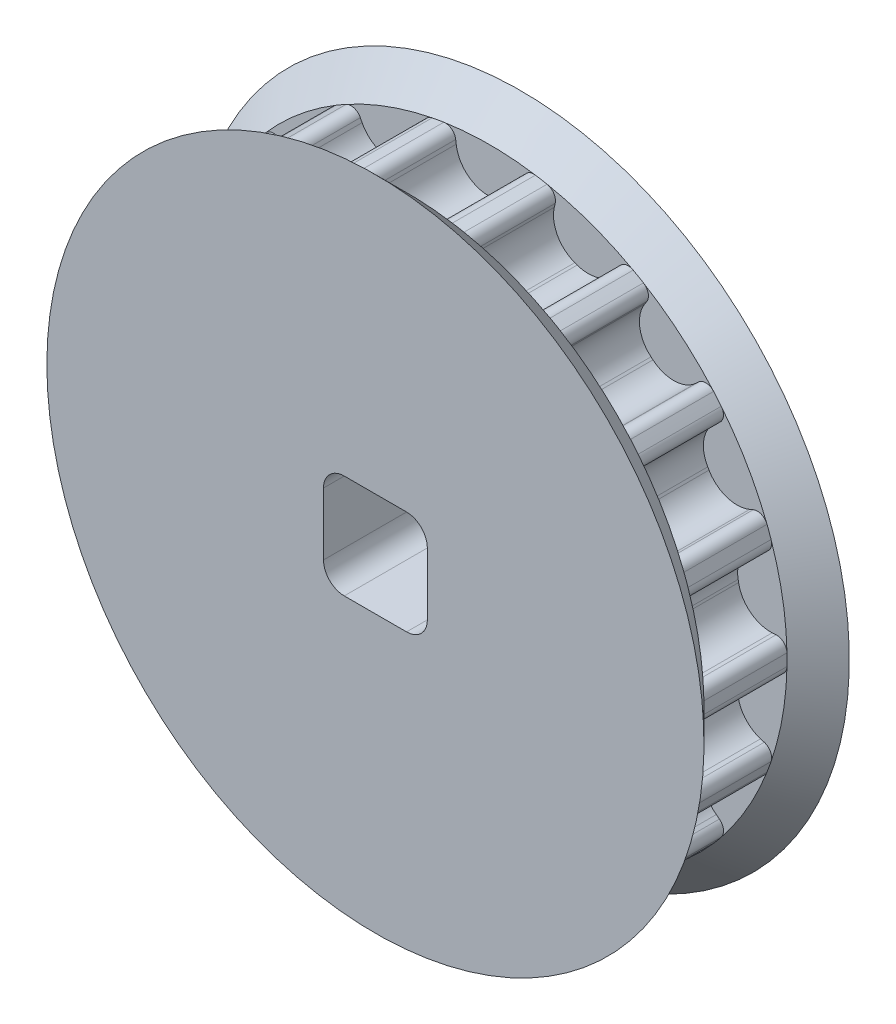
from build123d import *

# Parameters (mm, degrees)
EXTRUDE_1_DEPTH             = 2
SKETCH_3_R                  = 15.823944878
EXTRUDE_2_DEPTH             = 1.5
CHAMFER_1_SIZE              = 1.5
CHAMFER_1_OF_MIRROR_10_SIZE = 1.5
CUT_EXTRUDE_1_DEPTH         = 24.447696327


with BuildPart() as part:
    # 草图1 → 凸台-拉伸1 (new, symmetric)
    with BuildSketch(Plane.XY):
        with BuildLine():
            Line((-1.632898618, 13.71992731), (-1.610048582, 13.533828703))
            ThreePointArc((-1.610048582, 13.533828703), (-1.095363861, 12.555573954), (-0.061676586, 12.163944878))
            Line((-0.061676586, 12.163944878), (0.061676586, 12.163944878))
            ThreePointArc((0.061676586, 12.163944878), (1.095363861, 12.555573954), (1.610048582, 13.533828703))
            Line((1.610048582, 13.533828703), (1.632898618, 13.71992731))
            ThreePointArc((1.632898618, 13.71992731), (1.827776535, 14.057942458), (2.206181973, 14.15302646))
            ThreePointArc((2.206181973, 14.15302646), (2.346870584, 14.130378457), (2.487326925, 14.10633197))
            ThreePointArc((2.487326925, 14.10633197), (2.627537096, 14.080889378), (2.767487219, 14.054053201))
            ThreePointArc((2.767487219, 14.054053201), (3.090551372, 13.835281183), (3.158068723, 13.45099867))
            Line((3.158068723, 13.45099867), (3.115891261, 13.26830801))
            ThreePointArc((3.115891261, 13.26830801), (3.264953866, 12.173016699), (4.102357138, 11.451463876))
            Line((4.102357138, 11.451463876), (4.218271203, 11.409274607))
            ThreePointArc((4.218271203, 11.409274607), (5.323564541, 11.423743689), (6.141792805, 12.166969916))
            Line((6.141792805, 12.166969916), (6.226914287, 12.334030232))
            ThreePointArc((6.226914287, 12.334030232), (6.525647617, 12.585008398), (6.913753058, 12.544935852))
            ThreePointArc((6.913753058, 12.544935852), (7.038211035, 12.475535352), (7.161972439, 12.404900147))
            ThreePointArc((7.161972439, 12.404900147), (7.285025023, 12.333037229), (7.407356607, 12.25995371))
            ThreePointArc((7.407356607, 12.25995371), (7.636113171, 11.943880812), (7.568126368, 11.559681076))
            Line((7.568126368, 11.559681076), (7.466008632, 11.402433551))
            ThreePointArc((7.466008632, 11.402433551), (7.231469971, 10.322213976), (7.771586047, 9.357767326))
            Line((7.771586047, 9.357767326), (7.866080059, 9.278477435))
            ThreePointArc((7.866080059, 9.278477435), (8.909664769, 8.91404134), (9.932746171, 9.332594992))
            Line((9.932746171, 9.332594992), (10.069872193, 9.460467076))
            ThreePointArc((10.069872193, 9.460467076), (10.436429288, 9.594136591), (10.787423489, 9.423740836))
            ThreePointArc((10.787423489, 9.423740836), (10.880639362, 9.315958563), (10.972778378, 9.20725429))
            ThreePointArc((10.972778378, 9.20725429), (11.063831417, 9.097638774), (11.153789468, 8.987122864))
            ThreePointArc((11.153789468, 8.987122864), (11.260647026, 8.611872141), (11.065356279, 8.27409534))
            Line((11.065356279, 8.27409534), (10.915615176, 8.161257325))
            ThreePointArc((10.915615176, 8.161257325), (10.325764073, 7.226399907), (10.503446982, 6.135385929))
            Line((10.503446982, 6.135385929), (10.565123568, 6.028558949))
            ThreePointArc((10.565123568, 6.028558949), (11.421127934, 5.329174047), (12.525663758, 5.372571378))
            Line((12.525663758, 5.372571378), (12.698254898, 5.44583197))
            ThreePointArc((12.698254898, 5.44583197), (13.088423561, 5.446070317), (13.359971441, 5.165903596))
            ThreePointArc((13.359971441, 5.165903596), (13.410702001, 5.032739684), (13.460105303, 4.89907768))
            ThreePointArc((13.460105303, 4.89907768), (13.508176457, 4.764930815), (13.554910707, 4.630312365))
            ThreePointArc((13.554910707, 4.630312365), (13.526980659, 4.241144592), (13.227940916, 3.990531594))
            Line((13.227940916, 3.990531594), (13.048637432, 3.935713018))
            ThreePointArc((13.048637432, 3.935713018), (12.174618635, 3.258975359), (11.968437197, 2.172986441))
            Line((11.968437197, 2.172986441), (11.98985725, 2.051507281))
            ThreePointArc((11.98985725, 2.051507281), (12.555034512, 1.101529714), (13.607801437, 0.764536364))
            Line((13.607801437, 0.764536364), (13.795040655, 0.774349156))
            ThreePointArc((13.795040655, 0.774349156), (14.161760788, 0.641127587), (14.321109666, 0.284982142))
            ThreePointArc((14.321109666, 0.284982142), (14.323236058, 0.142498123), (14.323944878, 0))
            ThreePointArc((14.323944878, 0), (14.323236058, -0.142498123), (14.321109666, -0.284982142))
            ThreePointArc((14.321109666, -0.284982142), (14.161760788, -0.641127587), (13.795040655, -0.774349156))
            Line((13.795040655, -0.774349156), (13.607801437, -0.764536364))
            ThreePointArc((13.607801437, -0.764536364), (12.555034512, -1.101529714), (11.98985725, -2.051507281))
            Line((11.98985725, -2.051507281), (11.968437197, -2.172986441))
            ThreePointArc((11.968437197, -2.172986441), (12.174618635, -3.258975359), (13.048637432, -3.935713018))
            Line((13.048637432, -3.935713018), (13.227940916, -3.990531594))
            ThreePointArc((13.227940916, -3.990531594), (13.526980659, -4.241144592), (13.554910707, -4.630312365))
            ThreePointArc((13.554910707, -4.630312365), (13.508176457, -4.764930815), (13.460105303, -4.89907768))
            ThreePointArc((13.460105303, -4.89907768), (13.410702001, -5.032739684), (13.359971441, -5.165903596))
            ThreePointArc((13.359971441, -5.165903596), (13.088423561, -5.446070317), (12.698254898, -5.44583197))
            Line((12.698254898, -5.44583197), (12.525663758, -5.372571378))
            ThreePointArc((12.525663758, -5.372571378), (11.421127934, -5.329174047), (10.565123568, -6.028558949))
            Line((10.565123568, -6.028558949), (10.503446982, -6.135385929))
            ThreePointArc((10.503446982, -6.135385929), (10.325764073, -7.226399907), (10.915615176, -8.161257325))
            Line((10.915615176, -8.161257325), (11.065356279, -8.27409534))
            ThreePointArc((11.065356279, -8.27409534), (11.260647026, -8.611872141), (11.153789469, -8.987122864))
            ThreePointArc((11.153789469, -8.987122864), (11.063831417, -9.097638774), (10.972778378, -9.20725429))
            ThreePointArc((10.972778378, -9.20725429), (10.880639362, -9.315958563), (10.787423489, -9.423740836))
            ThreePointArc((10.787423489, -9.423740836), (10.436429288, -9.594136591), (10.069872193, -9.460467076))
            Line((10.069872193, -9.460467076), (9.932746171, -9.332594992))
            ThreePointArc((9.932746171, -9.332594992), (8.909664769, -8.91404134), (7.866080059, -9.278477435))
            Line((7.866080059, -9.278477435), (7.771586047, -9.357767326))
            ThreePointArc((7.771586047, -9.357767326), (7.231469971, -10.322213976), (7.466008632, -11.402433551))
            Line((7.466008632, -11.402433551), (7.568126368, -11.559681076))
            ThreePointArc((7.568126368, -11.559681076), (7.636113171, -11.943880812), (7.407356607, -12.25995371))
            ThreePointArc((7.407356607, -12.25995371), (7.285025023, -12.333037229), (7.161972439, -12.404900147))
            ThreePointArc((7.161972439, -12.404900147), (7.038211035, -12.475535352), (6.913753058, -12.544935852))
            ThreePointArc((6.913753058, -12.544935852), (6.525647617, -12.585008398), (6.226914287, -12.334030232))
            Line((6.226914287, -12.334030232), (6.141792805, -12.166969916))
            ThreePointArc((6.141792805, -12.166969916), (5.323564541, -11.423743689), (4.218271203, -11.409274607))
            Line((4.218271203, -11.409274607), (4.102357138, -11.451463876))
            ThreePointArc((4.102357138, -11.451463876), (3.264953866, -12.173016699), (3.115891261, -13.26830801))
            Line((3.115891261, -13.26830801), (3.158068723, -13.45099867))
            ThreePointArc((3.158068723, -13.45099867), (3.090551372, -13.835281183), (2.767487219, -14.054053201))
            ThreePointArc((2.767487219, -14.054053201), (2.627537096, -14.080889378), (2.487326925, -14.10633197))
            ThreePointArc((2.487326925, -14.10633197), (2.346870584, -14.130378457), (2.206181973, -14.15302646))
            ThreePointArc((2.206181973, -14.15302646), (1.827776535, -14.057942458), (1.632898618, -13.71992731))
            Line((1.632898618, -13.71992731), (1.610048582, -13.533828703))
            ThreePointArc((1.610048582, -13.533828703), (1.095363861, -12.555573954), (0.061676586, -12.163944878))
            Line((0.061676586, -12.163944878), (-0.061676586, -12.163944878))
            ThreePointArc((-0.061676586, -12.163944878), (-1.095363861, -12.555573954), (-1.610048582, -13.533828703))
            Line((-1.610048582, -13.533828703), (-1.632898618, -13.71992731))
            ThreePointArc((-1.632898618, -13.71992731), (-1.827776535, -14.057942458), (-2.206181973, -14.15302646))
            ThreePointArc((-2.206181973, -14.15302646), (-2.346870584, -14.130378457), (-2.487326925, -14.10633197))
            ThreePointArc((-2.487326925, -14.10633197), (-2.627537096, -14.080889378), (-2.767487219, -14.054053201))
            ThreePointArc((-2.767487219, -14.054053201), (-3.090551372, -13.835281183), (-3.158068723, -13.45099867))
            Line((-3.158068723, -13.45099867), (-3.115891261, -13.26830801))
            ThreePointArc((-3.115891261, -13.26830801), (-3.264953866, -12.173016699), (-4.102357138, -11.451463876))
            Line((-4.102357138, -11.451463876), (-4.218271203, -11.409274607))
            ThreePointArc((-4.218271203, -11.409274607), (-5.323564541, -11.423743689), (-6.141792805, -12.166969916))
            Line((-6.141792805, -12.166969916), (-6.226914287, -12.334030232))
            ThreePointArc((-6.226914287, -12.334030232), (-6.525647617, -12.585008398), (-6.913753058, -12.544935852))
            ThreePointArc((-6.913753058, -12.544935852), (-7.038211035, -12.475535352), (-7.161972439, -12.404900147))
            ThreePointArc((-7.161972439, -12.404900147), (-7.285025023, -12.333037229), (-7.407356607, -12.25995371))
            ThreePointArc((-7.407356607, -12.25995371), (-7.636113171, -11.943880812), (-7.568126368, -11.559681076))
            Line((-7.568126368, -11.559681076), (-7.466008632, -11.402433551))
            ThreePointArc((-7.466008632, -11.402433551), (-7.231469971, -10.322213976), (-7.771586047, -9.357767326))
            Line((-7.771586047, -9.357767326), (-7.866080059, -9.278477435))
            ThreePointArc((-7.866080059, -9.278477435), (-8.909664769, -8.91404134), (-9.932746171, -9.332594992))
            Line((-9.932746171, -9.332594992), (-10.069872193, -9.460467076))
            ThreePointArc((-10.069872193, -9.460467076), (-10.436429288, -9.594136591), (-10.787423489, -9.423740836))
            ThreePointArc((-10.787423489, -9.423740836), (-10.880639362, -9.315958563), (-10.972778378, -9.20725429))
            ThreePointArc((-10.972778378, -9.20725429), (-11.063831417, -9.097638774), (-11.153789468, -8.987122864))
            ThreePointArc((-11.153789468, -8.987122864), (-11.260647026, -8.611872141), (-11.065356279, -8.27409534))
            Line((-11.065356279, -8.27409534), (-10.915615176, -8.161257325))
            ThreePointArc((-10.915615176, -8.161257325), (-10.325764073, -7.226399907), (-10.503446982, -6.135385929))
            Line((-10.503446982, -6.135385929), (-10.565123568, -6.028558949))
            ThreePointArc((-10.565123568, -6.028558949), (-11.421127934, -5.329174047), (-12.525663758, -5.372571378))
            Line((-12.525663758, -5.372571378), (-12.698254898, -5.44583197))
            ThreePointArc((-12.698254898, -5.44583197), (-13.088423561, -5.446070317), (-13.359971441, -5.165903596))
            ThreePointArc((-13.359971441, -5.165903596), (-13.410702001, -5.032739684), (-13.460105303, -4.89907768))
            ThreePointArc((-13.460105303, -4.89907768), (-13.508176457, -4.764930815), (-13.554910707, -4.630312365))
            ThreePointArc((-13.554910707, -4.630312365), (-13.526980659, -4.241144592), (-13.227940916, -3.990531594))
            Line((-13.227940916, -3.990531594), (-13.048637432, -3.935713018))
            ThreePointArc((-13.048637432, -3.935713018), (-12.174618635, -3.258975359), (-11.968437197, -2.172986441))
            Line((-11.968437197, -2.172986441), (-11.98985725, -2.051507281))
            ThreePointArc((-11.98985725, -2.051507281), (-12.555034512, -1.101529714), (-13.607801437, -0.764536364))
            Line((-13.607801437, -0.764536364), (-13.795040655, -0.774349156))
            ThreePointArc((-13.795040655, -0.774349156), (-14.161760788, -0.641127587), (-14.321109666, -0.284982142))
            ThreePointArc((-14.321109666, -0.284982142), (-14.323236058, -0.142498123), (-14.323944878, 0))
            ThreePointArc((-14.323944878, 0), (-14.323236058, 0.142498123), (-14.321109666, 0.284982142))
            ThreePointArc((-14.321109666, 0.284982142), (-14.161760788, 0.641127587), (-13.795040655, 0.774349156))
            Line((-13.795040655, 0.774349156), (-13.607801437, 0.764536364))
            ThreePointArc((-13.607801437, 0.764536364), (-12.555034512, 1.101529714), (-11.98985725, 2.051507281))
            Line((-11.98985725, 2.051507281), (-11.968437197, 2.172986441))
            ThreePointArc((-11.968437197, 2.172986441), (-12.174618635, 3.258975359), (-13.048637432, 3.935713018))
            Line((-13.048637432, 3.935713018), (-13.227940916, 3.990531594))
            ThreePointArc((-13.227940916, 3.990531594), (-13.526980659, 4.241144592), (-13.554910707, 4.630312365))
            ThreePointArc((-13.554910707, 4.630312365), (-13.508176457, 4.764930815), (-13.460105303, 4.89907768))
            ThreePointArc((-13.460105303, 4.89907768), (-13.410702001, 5.032739684), (-13.359971441, 5.165903596))
            ThreePointArc((-13.359971441, 5.165903596), (-13.088423561, 5.446070317), (-12.698254898, 5.44583197))
            Line((-12.698254898, 5.44583197), (-12.525663758, 5.372571378))
            ThreePointArc((-12.525663758, 5.372571378), (-11.421127934, 5.329174047), (-10.565123568, 6.028558949))
            Line((-10.565123568, 6.028558949), (-10.503446982, 6.135385929))
            ThreePointArc((-10.503446982, 6.135385929), (-10.325764073, 7.226399907), (-10.915615176, 8.161257325))
            Line((-10.915615176, 8.161257325), (-11.065356279, 8.27409534))
            ThreePointArc((-11.065356279, 8.27409534), (-11.260647026, 8.611872141), (-11.153789468, 8.987122864))
            ThreePointArc((-11.153789468, 8.987122864), (-11.063831417, 9.097638774), (-10.972778378, 9.20725429))
            ThreePointArc((-10.972778378, 9.20725429), (-10.880639362, 9.315958563), (-10.787423489, 9.423740836))
            ThreePointArc((-10.787423489, 9.423740836), (-10.436429288, 9.594136591), (-10.069872193, 9.460467076))
            Line((-10.069872193, 9.460467076), (-9.932746171, 9.332594992))
            ThreePointArc((-9.932746171, 9.332594992), (-8.909664769, 8.91404134), (-7.866080059, 9.278477435))
            Line((-7.866080059, 9.278477435), (-7.771586047, 9.357767326))
            ThreePointArc((-7.771586047, 9.357767326), (-7.231469971, 10.322213976), (-7.466008632, 11.402433551))
            Line((-7.466008632, 11.402433551), (-7.568126368, 11.559681076))
            ThreePointArc((-7.568126368, 11.559681076), (-7.636113171, 11.943880812), (-7.407356607, 12.25995371))
            ThreePointArc((-7.407356607, 12.25995371), (-7.285025023, 12.333037229), (-7.161972439, 12.404900147))
            ThreePointArc((-7.161972439, 12.404900147), (-7.038211035, 12.475535352), (-6.913753058, 12.544935852))
            ThreePointArc((-6.913753058, 12.544935852), (-6.525647617, 12.585008398), (-6.226914287, 12.334030232))
            Line((-6.226914287, 12.334030232), (-6.141792805, 12.166969916))
            ThreePointArc((-6.141792805, 12.166969916), (-5.323564541, 11.423743689), (-4.218271203, 11.409274607))
            Line((-4.218271203, 11.409274607), (-4.102357138, 11.451463876))
            ThreePointArc((-4.102357138, 11.451463876), (-3.264953866, 12.173016699), (-3.115891261, 13.26830801))
            Line((-3.115891261, 13.26830801), (-3.158068723, 13.45099867))
            ThreePointArc((-3.158068723, 13.45099867), (-3.090551372, 13.835281183), (-2.767487219, 14.054053201))
            ThreePointArc((-2.767487219, 14.054053201), (-2.627537096, 14.080889378), (-2.487326925, 14.10633197))
            ThreePointArc((-2.487326925, 14.10633197), (-2.346870584, 14.130378457), (-2.206181973, 14.15302646))
            ThreePointArc((-2.206181973, 14.15302646), (-1.827776535, 14.057942458), (-1.632898618, 13.71992731))
        make_face()
    extrude(amount=EXTRUDE_1_DEPTH, both=True)

    # 草图3 → 凸台-拉伸2 (add)
    with BuildSketch(Plane(origin=(0, 0, -2), x_dir=(-1, 0, 0), z_dir=(0, 0, -1))):
        Circle(SKETCH_3_R)
    extrude_2 = extrude(amount=EXTRUDE_2_DEPTH)

    # 倒角1
    chamfer_1_edges = [part.edges().sort_by_distance(p)[0] for p in [
        (15.823944878, 0, -2),
    ]]
    chamfer(chamfer_1_edges, length=CHAMFER_1_SIZE - 0.0001)  # a hair under: the kernel refuses the full size

    # 镜向10: 凸台-拉伸2 across plane
    add(extrude_2.mirror(Plane.XY))

    # 倒角1 of 镜向10
    chamfer_1_of_mirror_10_edges = [part.edges().sort_by_distance(p)[0] for p in [
        (15.823944878, 0, 2),
    ]]
    chamfer(chamfer_1_of_mirror_10_edges, length=CHAMFER_1_OF_MIRROR_10_SIZE - 0.0001)  # a hair under: the kernel refuses the full size

    # 草图4 → 切除-拉伸1 (cut, through all)
    with BuildSketch(Plane(origin=(0, 0, -3.5), x_dir=(-1, 0, 0), z_dir=(0, 0, -1))):
        with BuildLine():
            Line((1.5, 2.5), (-1.5, 2.5))
            ThreePointArc((-1.5, 2.5), (-2.207106781, 2.207106781), (-2.5, 1.5))
            Line((-2.5, 1.5), (-2.5, -1.5))
            ThreePointArc((-2.5, -1.5), (-2.207106781, -2.207106781), (-1.5, -2.5))
            Line((-1.5, -2.5), (1.5, -2.5))
            ThreePointArc((1.5, -2.5), (2.207106781, -2.207106781), (2.5, -1.5))
            Line((2.5, -1.5), (2.5, 1.5))
            ThreePointArc((2.5, 1.5), (2.207106781, 2.207106781), (1.5, 2.5))
        make_face()
    extrude(amount=-CUT_EXTRUDE_1_DEPTH, mode=Mode.SUBTRACT)


solid = part.part
